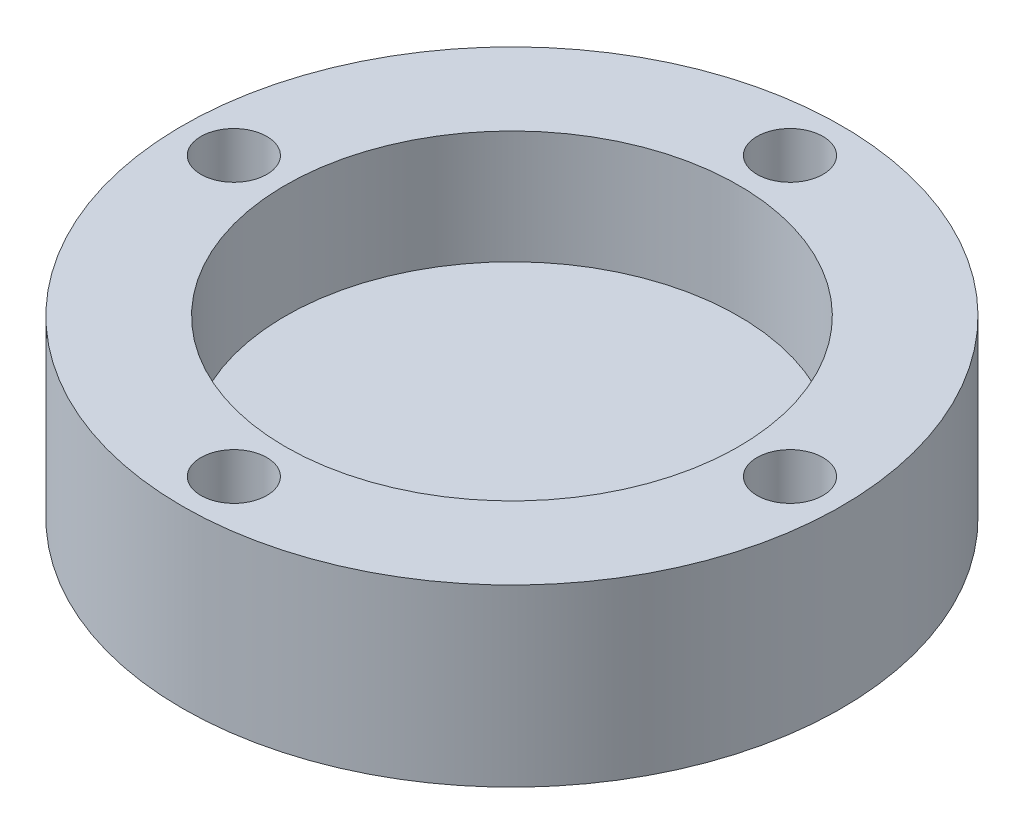
from build123d import *

# Parameters (mm, degrees)
ESQUISSE2_R                = 1.6
FIXINGHOLE_DEPTH           = 25.171263931
FIXINGHOLEREPETITION_COUNT = 4


with BuildPart() as part:
    # Esquisse1 → MainRevolution (revolve)
    with BuildSketch(Plane.XY):
        Polygon((11, 8.5), (11, 3), (0, 3), (0, 0), (16, 0), (16, 8.5), align=None)
    revolve(axis=Axis((0, 8.4, 0), (0, -1, 0)))

    # Esquisse2 → FixingHole (cut, through all)
    with BuildSketch(Plane(origin=(0, 8.5, 0), x_dir=(1, 0, 0), z_dir=(0, 1, 0))):
        with Locations((13.5, 0)):
            Circle(ESQUISSE2_R)
    fixinghole = extrude(amount=-FIXINGHOLE_DEPTH, mode=Mode.SUBTRACT)

    # FixingHoleRepetition: FixingHole ×4 about axis
    fixingholerepetition_axis = Axis((0, 8.4, 0), (0, -1, 0))
    for i in range(1, FIXINGHOLEREPETITION_COUNT):
        add(fixinghole.rotate(fixingholerepetition_axis, i * 360 / FIXINGHOLEREPETITION_COUNT), mode=Mode.SUBTRACT)


solid = part.part
